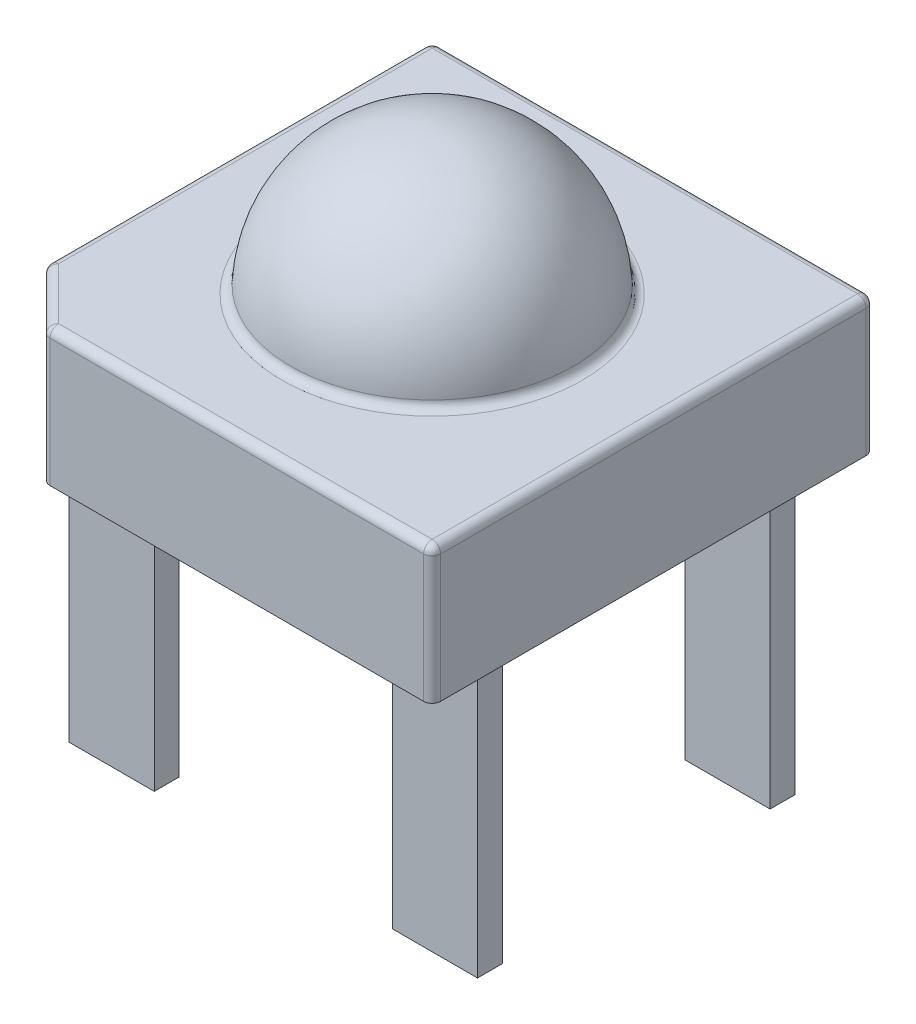
from build123d import *

# Parameters (mm, degrees)
EXTRUDE1_DEPTH = 2.4
FILLET1_R      = 0.15
SKETCH3_W      = 1.5
SKETCH3_H      = 0.44
EXTRUDE2_DEPTH = 4.85


with BuildPart() as part:
    # Sketch1 → Extrude1 (new body)
    with BuildSketch(Plane(origin=(0, 0, 0), x_dir=(1, 0, 0), z_dir=(0, 1, 0))):
        Polygon((-2.9, -3.9), (3.9, -3.9), (3.9, 3.9), (-3.9, 3.9), (-3.9, -2.9), align=None)
    extrude(amount=EXTRUDE1_DEPTH)

    # Sketch2 → Revolve1 (revolve)
    with BuildSketch(Plane.XY):
        with BuildLine():
            ThreePointArc((0, 4.9), (-1.767766953, 4.167766953), (-2.5, 2.4))
            Line((-2.5, 2.4), (0, 2.4))
            Line((0, 2.4), (0, 4.9))
        make_face()
    revolve(axis=Axis((0, 2.4, 0), (0, 1, 0)))

    # Fillet1
    fillet1_edges = [part.edges().sort_by_distance(p)[0] for p in [
        (2.5, 2.4, 0),
        (0.5, 2.4, 3.9),
        (-3.4, 2.4, 3.4),
        (-3.9, 2.4, -0.5),
        (0, 2.4, -3.9),
        (3.9, 2.4, 0),
        (-3.9, 1.2, -3.9),
        (3.9, 1.2, -3.9),
        (3.9, 1.2, 3.9),
        (-3.9, 1.2, 2.9),
        (-2.9, 1.2, 3.9),
    ]]
    fillet(fillet1_edges, radius=FILLET1_R)

    # Sketch3 → Extrude2 (add)
    with BuildSketch(Plane.XZ):
        with Locations((-2.85, 2.58)):
            Rectangle(SKETCH3_W, SKETCH3_H)
        with Locations((2.85, 2.58)):
            Rectangle(SKETCH3_W, SKETCH3_H)
        with Locations((2.85, -2.58)):
            Rectangle(SKETCH3_W, SKETCH3_H)
        with Locations((-2.85, -2.58)):
            Rectangle(SKETCH3_W, SKETCH3_H)
    extrude(amount=EXTRUDE2_DEPTH)


solid = part.part
